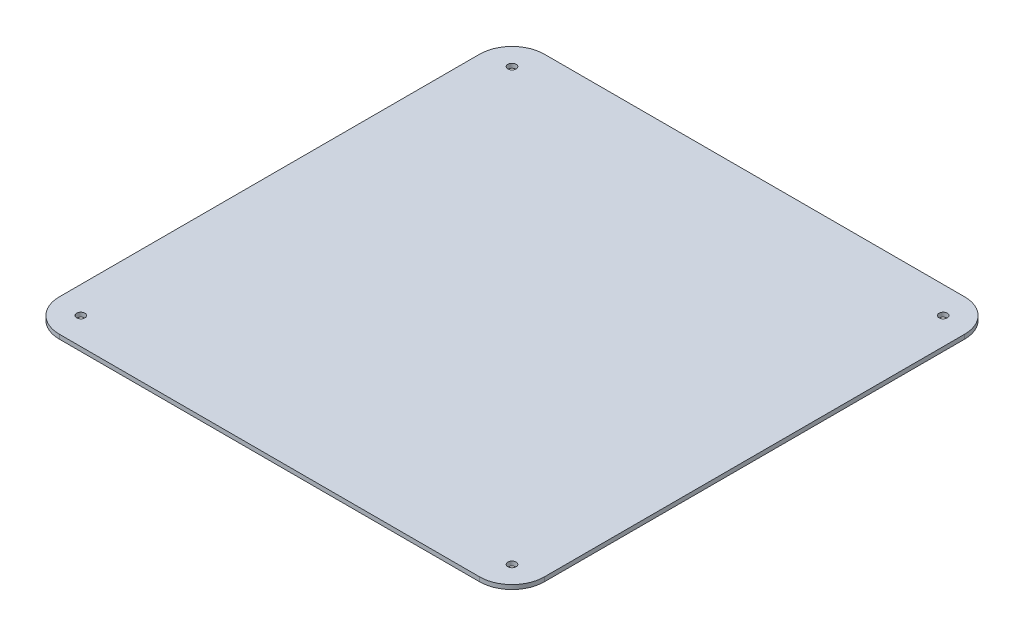
from build123d import *

# Parameters (mm, degrees)
SKETCH1_W            = 450
SKETCH1_H            = 450
BASE_FLANGE1_DEPTH   = 4
FILLET1_R            = 30
M7_CLEARANCE_HOLE1_D = 7.6


# Sheet-metal steps are written as plain solids
with BuildPart() as part:
    # Sketch1 → Base-Flange1 (new body)
    with BuildSketch(Plane(origin=(0, 0, 0), x_dir=(1, 0, 0), z_dir=(0, 1, 0))):
        Rectangle(SKETCH1_W, SKETCH1_H)
    extrude(amount=-BASE_FLANGE1_DEPTH)

    # Fillet1
    fillet1_edges = [part.edges().sort_by_distance(p)[0] for p in [
        (225, -2, 225),
        (-225, -2, 225),
        (-225, -2, -225),
        (225, -2, -225),
    ]]
    fillet(fillet1_edges, radius=FILLET1_R)

    # M7 Clearance Hole1 (through all)
    with Locations(Plane(origin=(0, 0, 0), x_dir=(1, 0, 0), z_dir=(0, 1, 0))):
        with Locations((200, 200), (-200, -200), (-200, 200), (200, -200)):
            Hole(M7_CLEARANCE_HOLE1_D / 2)


solid = part.part
